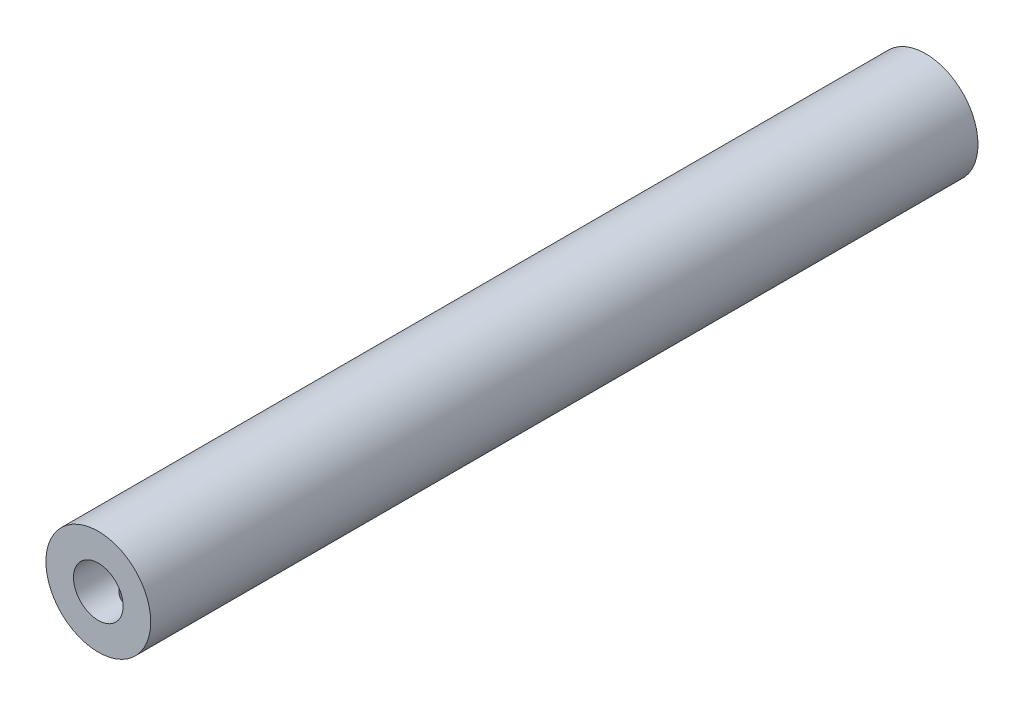
from build123d import *

# Parameters (mm, degrees)
SKETCH1_R           = 4.75
BOSS_EXTRUDE1_DEPTH = 75
SKETCH2_R           = 2.25
CUT_EXTRUDE1_DEPTH  = 12
SKETCH3_R           = 1.5
CUT_EXTRUDE2_DEPTH  = 76.300232403


with BuildPart() as part:
    # Sketch1 → Boss-Extrude1 (new body)
    with BuildSketch(Plane.XY):
        Circle(SKETCH1_R)
    extrude(amount=BOSS_EXTRUDE1_DEPTH)

    # Sketch2 → Cut-Extrude1 (cut)
    with BuildSketch(Plane.XY.offset(75)):
        Circle(SKETCH2_R)
    extrude(amount=-CUT_EXTRUDE1_DEPTH, mode=Mode.SUBTRACT)

    # Sketch3 → Cut-Extrude2 (cut, through all)
    with BuildSketch(Plane(origin=(0, 0, 0), x_dir=(1, 0, 0), z_dir=(0, 1, 0))):
        with Locations((0, -71)):
            Circle(SKETCH3_R)
    extrude(amount=-CUT_EXTRUDE2_DEPTH, mode=Mode.SUBTRACT)


solid = part.part
